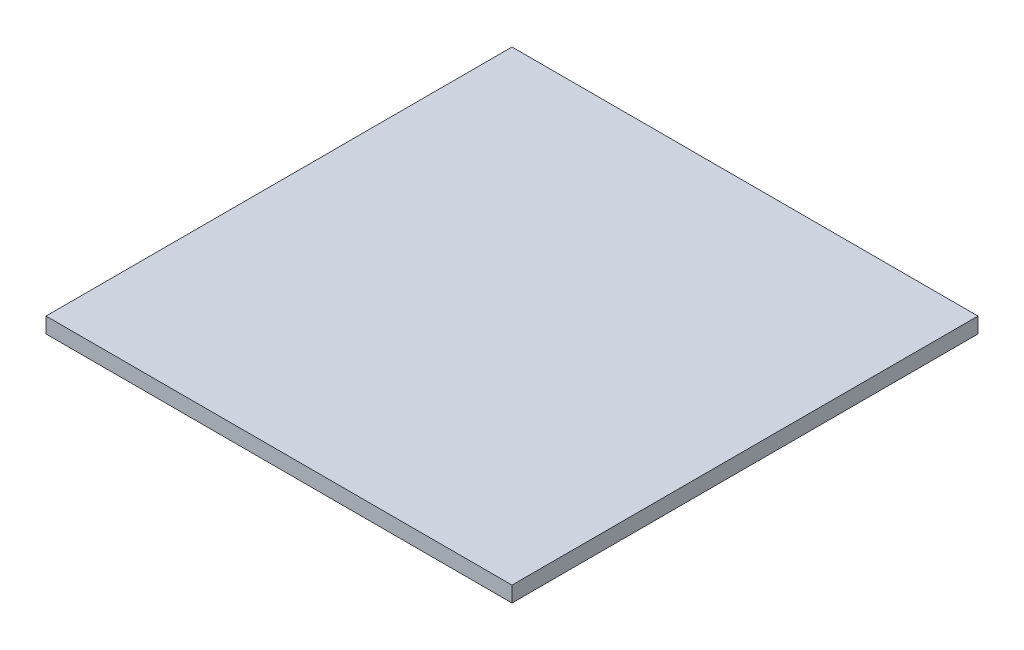
from build123d import *

# Parameters (mm, degrees)
SKETCH1_W           = 48
SKETCH1_H           = 48
BOSS_EXTRUDE1_DEPTH = 1.6


with BuildPart() as part:
    # Sketch1 → Boss-Extrude1 (new body)
    with BuildSketch(Plane(origin=(0, 0, 0), x_dir=(1, 0, 0), z_dir=(0, 1, 0))):
        Rectangle(SKETCH1_W, SKETCH1_H)
    extrude(amount=BOSS_EXTRUDE1_DEPTH)


solid = part.part
